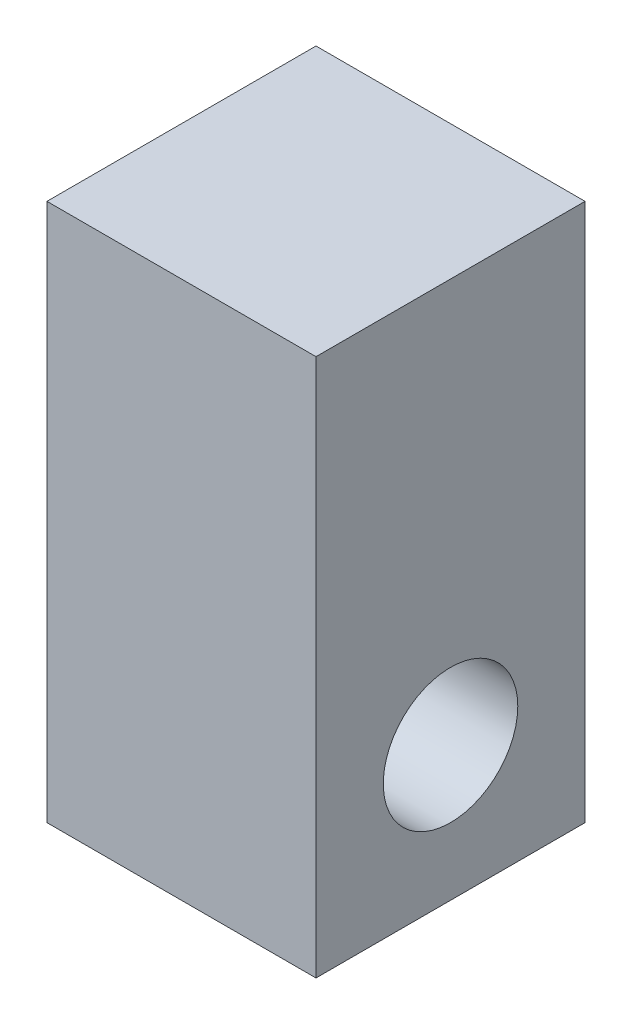
from build123d import *

# Parameters (mm, degrees)
SKETCH1_W           = 25.4
SKETCH1_H           = 25.4
BOSS_EXTRUDE1_DEPTH = 50.8
SKETCH2_R           = 6.35
CUT_EXTRUDE1_DEPTH  = 59.198711326


with BuildPart() as part:
    # Sketch1 → Boss-Extrude1 (new body)
    with BuildSketch(Plane(origin=(0, 0, 0), x_dir=(1, 0, 0), z_dir=(0, 1, 0))):
        Rectangle(SKETCH1_W, SKETCH1_H)
    extrude(amount=BOSS_EXTRUDE1_DEPTH)

    # Sketch2 → Cut-Extrude1 (cut, through all)
    with BuildSketch(Plane(origin=(12.7, 0, 0), x_dir=(0, 0, -1), z_dir=(1, 0, 0))):
        with Locations((0, 12.7)):
            Circle(SKETCH2_R)
    extrude(amount=-CUT_EXTRUDE1_DEPTH, mode=Mode.SUBTRACT)


solid = part.part
